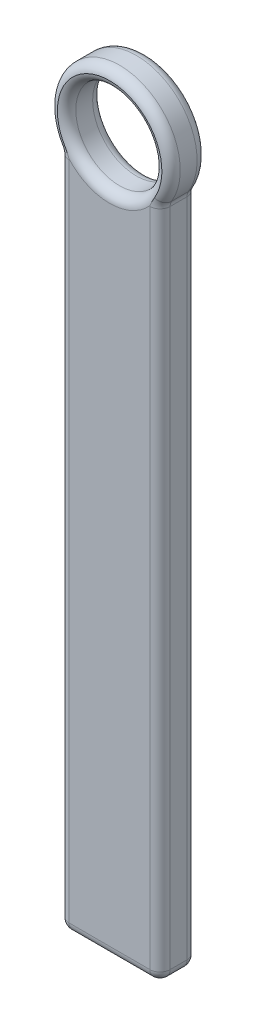
from build123d import *

# Parameters (mm, degrees)
SKETCH1_R           = 13
BOSS_EXTRUDE1_DEPTH = 5.5
FILLET2_R           = 3


with BuildPart() as part:
    # Sketch1 → Boss-Extrude1 (new, symmetric)
    with BuildSketch(Plane.XY):
        with BuildLine():
            Line((-15, -9.949874371), (-15, -209.949874371))
            Line((-15, -209.949874371), (15, -209.949874371))
            Line((15, -209.949874371), (15, -9.949874371))
            ThreePointArc((15, -9.949874371), (0, 18), (-15, -9.949874371))
        make_face()
        Circle(SKETCH1_R, mode=Mode.SUBTRACT)
    extrude(amount=BOSS_EXTRUDE1_DEPTH, both=True)

    # Fillet2
    # the kernel refuses this fillet: 3 mm, written as the material it adds along each edge
    with BuildSketch(Plane(origin=(15, -9.949874371, 5.5), x_dir=(0.5340574779916704, 0.8454481712093158, 0), z_dir=(0, 0, -1))) as fillet2_piece_1:
        with BuildLine():
            CenterArc((0.869355329, 2.999254564), FILLET2_R, 237.719985552, 31.002719134)
            Line((-0.732817105, 0.46291005), (0, 0))
            ThreePointArc((0, 0), (0.401240921, 0.004472619), (0.802481842, 0))
        make_face()
    extrude(amount=11)
    with BuildSketch(Plane(origin=(-15, -9.949874371, 5.5), x_dir=(0, -1, 0), z_dir=(0, 0, -1))) as fillet2_piece_2:
        with BuildLine():
            CenterArc((0.866779455, 3), FILLET2_R, 238.997280866, 31.002719134)
            ThreePointArc((-0.678456806, 0.428571429), (-0.336839767, 0.218067082), (0, 0))
            Line((0, 0), (0.866779455, 0))
        make_face()
    extrude(amount=11)
    # the kernel refuses this fillet: 3 mm, written as the material it takes off along each edge
    with BuildSketch(Plane(origin=(0, 0, -5.5), x_dir=(1, 0, 0), z_dir=(0, -1, 0))) as fillet2_2_piece_1:
        with BuildLine():
            CenterArc((13 + FILLET2_R, FILLET2_R), FILLET2_R, 180, 90)
            Line((13, FILLET2_R), (13, 0))
            Line((13, 0), (13 + FILLET2_R, 0))
        make_face()
    revolve(axis=Axis((0, 0, -5.5), (0, 0, 1)), mode=Mode.SUBTRACT)
    with BuildSketch(Plane(origin=(0, 0, 5.5), x_dir=(1, 0, 0), z_dir=(0, -1, 0))) as fillet2_2_piece_2:
        with BuildLine():
            CenterArc((13 + FILLET2_R, -FILLET2_R), FILLET2_R, 90, 90)
            Line((13, -FILLET2_R), (13, 0))
            Line((13, 0), (13 + FILLET2_R, 0))
        make_face()
    revolve(axis=Axis((0, 0, 5.5), (0, 0, 1)), mode=Mode.SUBTRACT)
    with BuildSketch(Plane(origin=(-22.5, -209.949874371, 5.5), x_dir=(0, 1, 0), z_dir=(1, 0, 0)), Plane(origin=(-22.5, -209.949874371, -5.5), x_dir=(0, 0, 1), z_dir=(1, 0, 0))) as fillet2_2_piece_3:
        with BuildLine():
            CenterArc((FILLET2_R, -FILLET2_R), FILLET2_R, 90, 90)
            Line((0, -FILLET2_R), (0, 0))
            Line((0, 0), (FILLET2_R, 0))
        make_face()
    extrude(amount=45, mode=Mode.SUBTRACT)
    with BuildSketch(Plane(origin=(15, -209.949874371, -13), x_dir=(-1, 0, 0), z_dir=(0, 0, 1)), Plane(origin=(-15, -209.949874371, -13), x_dir=(0, 1, 0), z_dir=(0, 0, 1))) as fillet2_2_piece_4:
        with BuildLine():
            CenterArc((FILLET2_R, -FILLET2_R), FILLET2_R, 90, 90)
            Line((0, -FILLET2_R), (0, 0))
            Line((0, 0), (FILLET2_R, 0))
        make_face()
    extrude(amount=26, mode=Mode.SUBTRACT)
    # the kernel refuses this fillet: 3 mm, written as the material it takes off along each edge
    with BuildSketch(Plane(origin=(-12, -206.949874371, 2.5), x_dir=(0, 0, 1), z_dir=(-1, 0, 0))) as fillet2_3_piece_1_section:
        Polygon((0, 0), (FILLET2_R, 0), (FILLET2_R, -FILLET2_R), (0, -FILLET2_R), align=None)
    fillet2_3_piece_1 = extrude(amount=FILLET2_R, mode=Mode.PRIVATE)
    fillet2_3_piece_1 = fillet2_3_piece_1 - Plane(origin=(-12, -206.949874371, 2.5), x_dir=(0, 0.7071067811865475, -0.7071067811865475), z_dir=(-1, 0, 0)) * Sphere(FILLET2_R, mode=Mode.PRIVATE)
    add(fillet2_3_piece_1, mode=Mode.SUBTRACT)
    with BuildSketch(Plane(origin=(-12, -206.949874371, -2.5), x_dir=(0, 0, -1), z_dir=(-1, 0, 0))) as fillet2_3_piece_2_section:
        Polygon((0, 0), (FILLET2_R, 0), (FILLET2_R, FILLET2_R), (0, FILLET2_R), align=None)
    fillet2_3_piece_2 = extrude(amount=FILLET2_R, mode=Mode.PRIVATE)
    fillet2_3_piece_2 = fillet2_3_piece_2 - Plane(origin=(-12, -206.949874371, -2.5), x_dir=(0, 0.7071067811865475, 0.7071067811865475), z_dir=(-1, 0, 0)) * Sphere(FILLET2_R, mode=Mode.PRIVATE)
    add(fillet2_3_piece_2, mode=Mode.SUBTRACT)
    with BuildSketch(Plane(origin=(12, -206.949874371, -2.5), x_dir=(1, 0, 0), z_dir=(0, 0, -1))) as fillet2_3_piece_3_section:
        Polygon((0, 0), (FILLET2_R, 0), (FILLET2_R, FILLET2_R), (0, FILLET2_R), align=None)
    fillet2_3_piece_3 = extrude(amount=FILLET2_R, mode=Mode.PRIVATE)
    fillet2_3_piece_3 = fillet2_3_piece_3 - Plane(origin=(12, -206.949874371, -2.5), x_dir=(-0.7071067811865475, 0.7071067811865475, 0), z_dir=(0, 0, -1)) * Sphere(FILLET2_R, mode=Mode.PRIVATE)
    add(fillet2_3_piece_3, mode=Mode.SUBTRACT)
    with BuildSketch(Plane(origin=(12, -206.949874371, 2.5), x_dir=(1, 0, 0), z_dir=(0, 0, 1))) as fillet2_3_piece_4_section:
        Polygon((0, 0), (FILLET2_R, 0), (FILLET2_R, -FILLET2_R), (0, -FILLET2_R), align=None)
    fillet2_3_piece_4 = extrude(amount=FILLET2_R, mode=Mode.PRIVATE)
    fillet2_3_piece_4 = fillet2_3_piece_4 - Plane(origin=(12, -206.949874371, 2.5), x_dir=(-0.7071067811865475, 0.7071067811865475, 0), z_dir=(0, 0, 1)) * Sphere(FILLET2_R, mode=Mode.PRIVATE)
    add(fillet2_3_piece_4, mode=Mode.SUBTRACT)
    with BuildSketch(Plane(origin=(15, -206.949874371, 5.5), x_dir=(-1, 0, 0), z_dir=(0, 1, 0)), Plane(origin=(-15, -10.816653826, -5.5), x_dir=(0, 0, 1), z_dir=(0, -1, 0))) as fillet2_3_piece_5:
        with BuildLine():
            CenterArc((FILLET2_R, -FILLET2_R), FILLET2_R, 90, 90)
            Line((0, -FILLET2_R), (0, 0))
            Line((0, 0), (FILLET2_R, 0))
        make_face()
    extrude(amount=196.133220545, mode=Mode.SUBTRACT)
    with BuildSketch(Plane(origin=(0, 0, 5.5), x_dir=(0.8571428571428582, -0.5150787536377108, 0), z_dir=(-0.5150787536377108, -0.8571428571428582, 0))) as fillet2_3_piece_6:
        with BuildLine():
            CenterArc((18 - FILLET2_R, -FILLET2_R), FILLET2_R, 0, 90)
            Line((18, -FILLET2_R), (18, 0))
            Line((18, 0), (18 - FILLET2_R, 0))
        make_face()
    revolve(axis=Axis((0, 0, 5.5), (0, 0, 1)), revolution_arc=242.005438268, mode=Mode.SUBTRACT)
    with BuildSketch(Plane(origin=(15, -206.949874371, -5.5), x_dir=(-1, 0, 0), z_dir=(0, 1, 0)), Plane(origin=(-15, -10.816653826, 5.5), x_dir=(0, 0, -1), z_dir=(0, -1, 0))) as fillet2_3_piece_7:
        with BuildLine():
            CenterArc((FILLET2_R, FILLET2_R), FILLET2_R, 180, 90)
            Line((0, FILLET2_R), (0, 0))
            Line((0, 0), (FILLET2_R, 0))
        make_face()
    extrude(amount=196.133220545, mode=Mode.SUBTRACT)
    with BuildSketch(Plane(origin=(0, 0, -5.5), x_dir=(0.8571428571428582, -0.5150787536377108, 0), z_dir=(-0.5150787536377108, -0.8571428571428582, 0))) as fillet2_3_piece_8:
        with BuildLine():
            CenterArc((18 - FILLET2_R, FILLET2_R), FILLET2_R, 270, 90)
            Line((18, FILLET2_R), (18, 0))
            Line((18, 0), (18 - FILLET2_R, 0))
        make_face()
    revolve(axis=Axis((0, 0, -5.5), (0, 0, 1)), revolution_arc=242.005438268, mode=Mode.SUBTRACT)
    with BuildSketch(Plane(origin=(-18, -10.816653826, 5.5), x_dir=(1, 0, 0), z_dir=(0, -1, 0))) as fillet2_3_piece_9:
        with BuildLine():
            CenterArc((3 + FILLET2_R, -FILLET2_R), FILLET2_R, 90, 90)
            Line((3, -FILLET2_R), (3, 0))
            Line((3, 0), (3 + FILLET2_R, 0))
        make_face()
    revolve(axis=Axis((-18, -10.816653826, 5.5), (0, 0, 1)), revolution_arc=31.002719134, mode=Mode.SUBTRACT)
    with BuildSketch(Plane(origin=(18, -10.816653826, -5.5), x_dir=(-0.8571428571428581, 0.5150787536377112, 0), z_dir=(0.5150787536377112, 0.8571428571428581, 0))) as fillet2_3_piece_10:
        with BuildLine():
            CenterArc((3 + FILLET2_R, FILLET2_R), FILLET2_R, 180, 90)
            Line((3, FILLET2_R), (3, 0))
            Line((3, 0), (3 + FILLET2_R, 0))
        make_face()
    revolve(axis=Axis((18, -10.816653826, -5.5), (0, 0, 1)), revolution_arc=31.002719134, mode=Mode.SUBTRACT)
    with BuildSketch(Plane(origin=(-18, -10.816653826, -5.5), x_dir=(1, 0, 0), z_dir=(0, -1, 0))) as fillet2_3_piece_11:
        with BuildLine():
            CenterArc((3 + FILLET2_R, FILLET2_R), FILLET2_R, 180, 90)
            Line((3, FILLET2_R), (3, 0))
            Line((3, 0), (3 + FILLET2_R, 0))
        make_face()
    revolve(axis=Axis((-18, -10.816653826, -5.5), (0, 0, 1)), revolution_arc=31.002719134, mode=Mode.SUBTRACT)
    with BuildSketch(Plane(origin=(18, -10.816653826, 5.5), x_dir=(-0.8571428571428581, 0.5150787536377112, 0), z_dir=(0.5150787536377112, 0.8571428571428581, 0))) as fillet2_3_piece_12:
        with BuildLine():
            CenterArc((3 + FILLET2_R, -FILLET2_R), FILLET2_R, 90, 90)
            Line((3, -FILLET2_R), (3, 0))
            Line((3, 0), (3 + FILLET2_R, 0))
        make_face()
    revolve(axis=Axis((18, -10.816653826, 5.5), (0, 0, 1)), revolution_arc=31.002719134, mode=Mode.SUBTRACT)


solid = part.part
